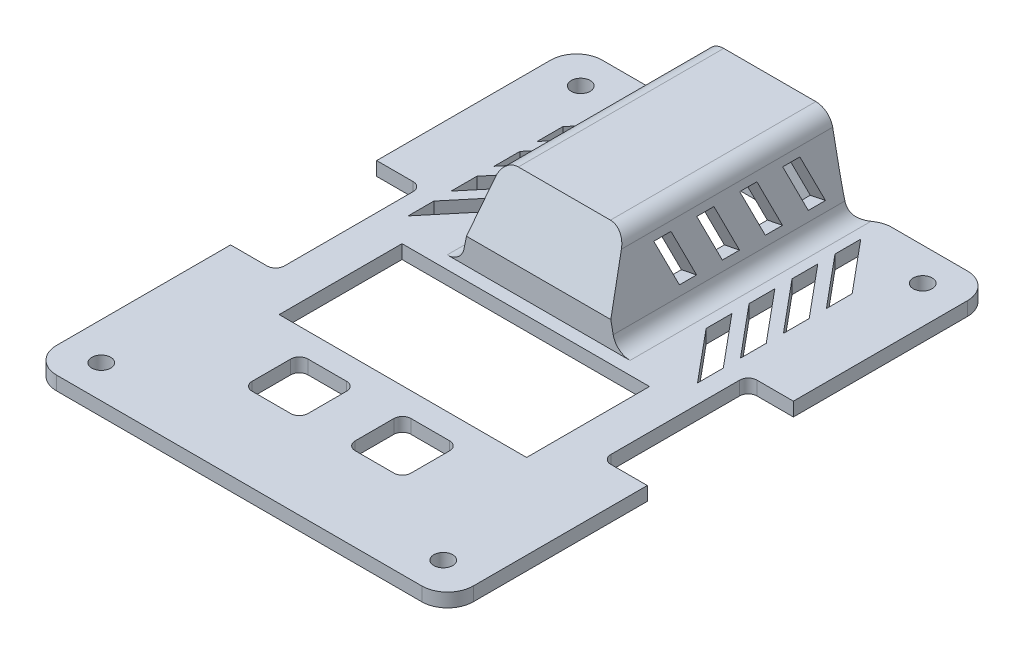
from build123d import *

# Parameters (mm, degrees)
EXTRUDE_1_DEPTH          = 1.6
SKETCH_2_R               = 1.1
CUT_EXTRUDE_1_DEPTH      = 40.983559121
FILLET_1_R               = 1
SKETCH_4_W               = 6.5
SKETCH_4_H               = 6.5
CUT_EXTRUDE_2_DEPTH      = 40.983559121
FILLET_2_R               = 1
SKETCH_8_W               = 28.8
SKETCH_8_H               = 14.3
CUT_EXTRUDE_3_DEPTH      = 1.6
EXTRUDE_START            = -1.75
EXTRUDE_2_DEPTH          = 26.9
CUT_EXTRUDE_4_DEPTH      = 42.601502377
CUT_EXTRUDE_4_DEPTH_BACK = 42.601502377
CUT_EXTRUDE_6_DEPTH      = 42.18403817
SHELL_START              = -28.2
SHELL_3_DEPTH            = 23.3
SHELL_START_2            = -2.83732082
SHELL_3_2_DEPTH          = 1.8
FILLET_3_R               = 3
SKETCH_15_R              = 3.1
CUT_EXTRUDE_8_DEPTH      = 1.8
FILLET_5_R               = 2
CUT_EXTRUDE_9_DEPTH      = 42.18403817
CUT_EXTRUDE_START        = -1.8
CUT_EXTRUDE_10_DEPTH     = 1.8


with BuildPart() as part:
    # 草图1 → 凸台-拉伸1 (new body)
    with BuildSketch(Plane(origin=(0, 0, 0), x_dir=(1, 0, 0), z_dir=(0, 1, 0))):
        with BuildLine():
            Line((-24.25, 8.5), (-19, 8.5))
            Line((-19, 8.5), (-19, -8.5))
            Line((-19, -8.5), (-24.25, -8.5))
            Line((-24.25, -8.5), (-24.25, -28.75))
            ThreePointArc((-24.25, -28.75), (-23.371320344, -30.871320344), (-21.25, -31.75))
            Line((-21.25, -31.75), (21.25, -31.75))
            ThreePointArc((21.25, -31.75), (23.371320344, -30.871320344), (24.25, -28.75))
            Line((24.25, -28.75), (24.25, -8.5))
            Line((24.25, -8.5), (19, -8.5))
            Line((19, -8.5), (19, 8.5))
            Line((19, 8.5), (24.25, 8.5))
            Line((24.25, 8.5), (24.25, 28.75))
            ThreePointArc((24.25, 28.75), (23.371320344, 30.871320344), (21.25, 31.75))
            Line((21.25, 31.75), (-21.25, 31.75))
            ThreePointArc((-21.25, 31.75), (-23.371320344, 30.871320344), (-24.25, 28.75))
            Line((-24.25, 28.75), (-24.25, 8.5))
        make_face()
    extrude(amount=EXTRUDE_1_DEPTH)

    # 草图2 → 切除-拉伸1 (cut, through all)
    with BuildSketch(Plane(origin=(0, 1.6, 0), x_dir=(1, 0, 0), z_dir=(0, 1, 0))):
        with Locations(Location((-19.9, 27.9, 0), (0, 0, 270))):
            Circle(SKETCH_2_R)
        with Locations(Location((19.9, 27.9, 0), (0, 0, 90))):
            Circle(SKETCH_2_R)
        with Locations(Location((19.9, -27.9, 0), (0, 0, 270))):
            Circle(SKETCH_2_R)
        with Locations(Location((-19.9, -27.9, 0), (0, 0, 90))):
            Circle(SKETCH_2_R)
    extrude(amount=-CUT_EXTRUDE_1_DEPTH, mode=Mode.SUBTRACT)

    # 圆角1
    fillet_1_edges = [part.edges().sort_by_distance(p)[0] for p in [
        (19, 0.8, -8.5),
        (19, 0.8, 8.5),
        (-19, 0.8, 8.5),
        (-19, 0.8, -8.5),
    ]]
    fillet(fillet_1_edges, radius=FILLET_1_R)

    # 草图4 → 切除-拉伸2 (cut, through all)
    with BuildSketch(Plane(origin=(0, 1.6, 0), x_dir=(1, 0, 0), z_dir=(0, 1, 0))):
        with Locations((-6, -18.75)):
            Rectangle(SKETCH_4_W, SKETCH_4_H)
        with Locations((6, -18.75)):
            Rectangle(SKETCH_4_W, SKETCH_4_H)
    extrude(amount=-CUT_EXTRUDE_2_DEPTH, mode=Mode.SUBTRACT)

    # 圆角2
    fillet_2_edges = [part.edges().sort_by_distance(p)[0] for p in [
        (-2.75, 0.8, 15.5),
        (-2.75, 0.8, 22),
        (9.25, 0.8, 15.5),
        (9.25, 0.8, 22),
        (2.75, 0.8, 22),
        (2.75, 0.8, 15.5),
        (-9.25, 0.8, 22),
        (-9.25, 0.8, 15.5),
    ]]
    fillet(fillet_2_edges, radius=FILLET_2_R)

    # 草图8 → 切除-拉伸3 (cut)
    with BuildSketch(Plane(origin=(0, 1.6, 0), x_dir=(1, 0, 0), z_dir=(0, 1, 0))):
        with Locations((0, -5.55)):
            Rectangle(SKETCH_8_W, SKETCH_8_H)
    extrude(amount=-CUT_EXTRUDE_3_DEPTH, mode=Mode.SUBTRACT)

    # 草图10 → 凸台-拉伸2 (add)
    with BuildSketch(Plane(origin=(0, 0, -31.75), x_dir=(-1, 0, 0), z_dir=(0, 0, -1)).offset(EXTRUDE_START)):
        Polygon((-9, 1.6), (9, 1.6), (7, 11.6), (-7, 11.6), align=None)
    extrude(amount=-EXTRUDE_2_DEPTH)

    # 草图11 → 切除-拉伸4 (cut, two sides: drawn at the far end of the back side and taken through both)
    with BuildSketch(Plane(origin=(0, 0, 0), x_dir=(0, 0, -1), z_dir=(1, 0, 0)).offset(-CUT_EXTRUDE_4_DEPTH_BACK)):
        Polygon((6.1, 11.6), (3.1, 4.6), (3.1, 11.6), align=None)
    extrude(amount=CUT_EXTRUDE_4_DEPTH + CUT_EXTRUDE_4_DEPTH_BACK, mode=Mode.SUBTRACT)

    # 草图14 → 切除-拉伸6 (cut, through all)
    with BuildSketch(Plane(origin=(0, 1.6, 0), x_dir=(1, 0, 0), z_dir=(0, 1, 0))):
        Polygon((-9, 30), (9, 30), (11.5, 31.75), (-11.5, 31.75), align=None)
    extrude(amount=-CUT_EXTRUDE_6_DEPTH, mode=Mode.SUBTRACT)

    # 抽壳3: read off the stored shape, not the designer's step
    # 抽壳3 outline → 抽壳3 (cut)
    with BuildSketch(Plane.XY.offset(SHELL_START)):
        Polygon((-7.484352975, 0), (7.484352975, 0), (5.524352975, 9.8), (-5.524352975, 9.8), align=None)
    extrude(amount=SHELL_3_DEPTH, mode=Mode.SUBTRACT)

    # Shell 3 2 outline → Shell 3 2 (add)
    with BuildSketch(Plane(origin=(0, 0, 0), x_dir=(1, 0, 0), z_dir=(0, 0.3939192985791679, 0.9191450300180578)).offset(SHELL_START_2)):
        Polygon((6.638245748, 5.818680827), (5.524352975, 11.878076985), (-5.524352975, 11.878076985), (-6.638245748, 5.818680827), align=None)
    extrude(amount=SHELL_3_2_DEPTH)

    # 圆角3
    fillet_3_edges = [part.edges().sort_by_distance(p)[0] for p in [
        (-11.5, 0.8, -31.75),
        (11.5, 0.8, -31.75),
        (9, 0.8, -30),
        (-9, 0.8, -30),
    ]]
    fillet(fillet_3_edges, radius=FILLET_3_R)

    # 草图15 → 切除-拉伸8 (cut)
    with BuildSketch(Plane(origin=(0, 0, -30), x_dir=(-1, 0, 0), z_dir=(0, 0, -1))):
        with Locations((0, 5.1)):
            Circle(SKETCH_15_R)
    extrude(amount=-CUT_EXTRUDE_8_DEPTH, mode=Mode.SUBTRACT)

    # 圆角5
    fillet_5_edges = [part.edges().sort_by_distance(p)[0] for p in [
        (9, 1.6, -16.626473173),
        (-9, 1.6, -16.626473173),
        (7, 11.6, -18.05),
        (-7, 11.6, -18.05),
    ]]
    fillet(fillet_5_edges, radius=FILLET_5_R)

    # 草图16 → 切除-拉伸9 (cut, through all)
    with BuildSketch(Plane(origin=(0, 1.6, 0), x_dir=(1, 0, 0), z_dir=(0, 1, 0))):
        Polygon((-11.839607805, 25.75), (-11.839607805, 28.75), (-16.839607805, 22.75), (-16.839607805, 19.75), align=None)
        Polygon((-11.839607805, 20.75), (-11.839607805, 23.75), (-16.839607805, 17.75), (-16.839607805, 14.75), align=None)
        Polygon((-11.839607805, 15.75), (-11.839607805, 18.75), (-16.839607805, 12.75), (-16.839607805, 9.75), align=None)
        Polygon((-11.839607805, 10.75), (-11.839607805, 13.75), (-16.839607805, 7.75), (-16.839607805, 4.75), align=None)
    cut_extrude_9 = extrude(amount=-CUT_EXTRUDE_9_DEPTH, mode=Mode.SUBTRACT)

    # 镜向1: 切除-拉伸9 across plane
    add(cut_extrude_9.mirror(Plane(origin=(0, 0, 0), x_dir=(0, 0, 1), z_dir=(1, 0, 0))), mode=Mode.SUBTRACT)

    # 草图18 → 切除-拉伸10 (cut)
    with BuildSketch(Plane(origin=(-8.961538462, 1.792307692, 0), x_dir=(0, 0, 1), z_dir=(-0.9805806756909202, 0.19611613513818404, 0)).offset(CUT_EXTRUDE_START)):
        Polygon((-28, 2.44349167), (-26, 2.44349167), (-24, 7.44349167), (-26, 7.44349167), align=None)
        Polygon((-23, 2.44349167), (-21, 2.44349167), (-19, 7.44349167), (-21, 7.44349167), align=None)
        Polygon((-18, 2.44349167), (-16, 2.44349167), (-14, 7.44349167), (-16, 7.44349167), align=None)
        Polygon((-13, 2.44349167), (-11, 2.44349167), (-9, 7.44349167), (-11, 7.44349167), align=None)
    cut_extrude_10 = extrude(amount=CUT_EXTRUDE_10_DEPTH, mode=Mode.SUBTRACT)

    # 镜向2: 切除-拉伸10 across plane
    add(cut_extrude_10.mirror(Plane(origin=(0, 0, 0), x_dir=(0, 0, 1), z_dir=(1, 0, 0))), mode=Mode.SUBTRACT)


solid = part.part
